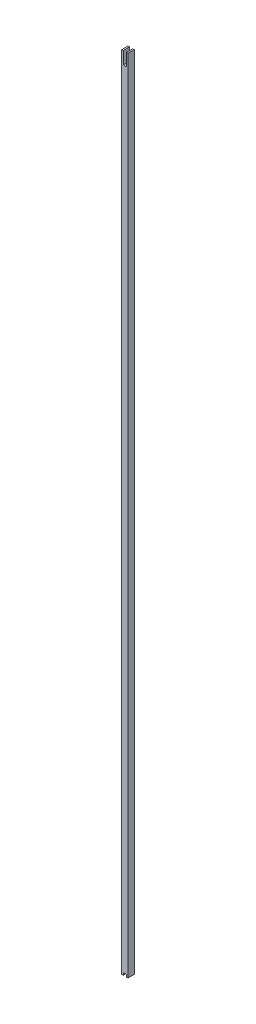
from build123d import *

# Parameters (mm, degrees)
BOSS_EXTRUDE1_DEPTH = 6.35


with BuildPart() as part:
    # Sketch1 → Boss-Extrude1 (new body)
    with BuildSketch(Plane.XY):
        Polygon((0, 0), (1.5875, 0), (1.5875, 2.38125), (4.7625, 2.38125), (4.7625, 0), (6.35, 0), (6.35, 812.8), (4.7625, 812.8), (4.7625, 800.1), (1.5875, 800.1), (1.5875, 812.8), (0, 812.8), align=None)
    extrude(amount=BOSS_EXTRUDE1_DEPTH)


solid = part.part
